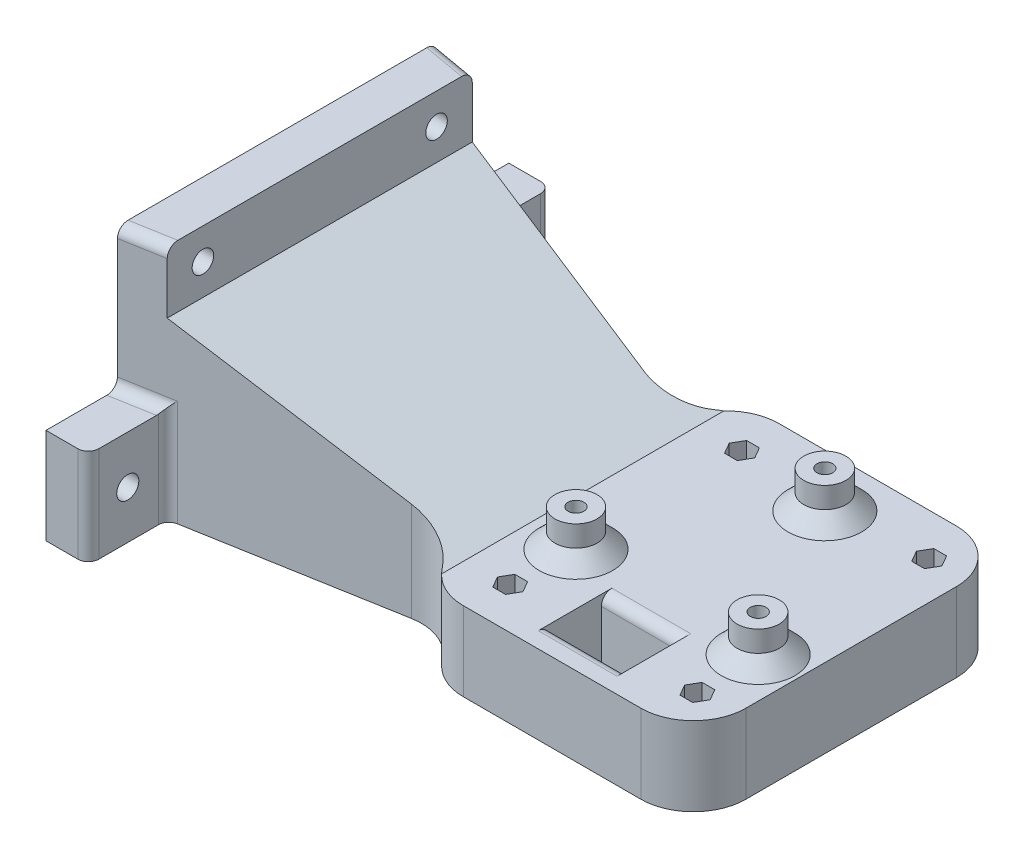
from build123d import *

# Parameters (mm, degrees)
EXTRUDE_1_DEPTH      = 5
EXTRUDE_1_DEPTH_BACK = 10
SKETCH_1_W           = 50
SKETCH_1_H           = 60
SKETCH_1_R           = 1
SKETCH_1_R_2         = 1.5
FILLET_1_R           = 10
SKETCH_5_R           = 4
SKETCH_5_R_2         = 1.5
EXTRUDE_3_DEPTH      = 7
SKETCH_6_R           = 3.5
CUT_EXTRUDE_1_DEPTH  = 6
SKETCH_7_W           = 15
SKETCH_7_H           = 10
CUT_EXTRUDE_2_DEPTH  = 42.833001327
CUT_EXTRUDE_3_DEPTH  = 10
CHAMFER_1_SIZE       = 3
FILLET_6_R           = 10
EXTRUDE_7_DEPTH      = 15
EXTRUDE_8_DEPTH      = 30
CHAMFER_2_SIZE       = 50
CHAMFER_2_SIZE2      = 18.198511713
SKETCH_16_R          = 2.05
CUT_EXTRUDE_4_DEPTH  = 30
FILLET_7_R           = 10
FILLET_8_R           = 10
SKETCH_17_W          = 15
SKETCH_17_H          = 18.198511713
SKETCH_17_R          = 2.1
EXTRUDE_9_DEPTH      = 8.046928804
FILLET_9_R           = 2
FILLET_10_R          = 2


with BuildPart() as part:
    # 草图1 → 凸台-拉伸1 (new, two sides: drawn at the far end of the back side and taken through both)
    with BuildSketch(Plane(origin=(0, 0, 0), x_dir=(1, 0, 0), z_dir=(0, 1, 0)).offset(-EXTRUDE_1_DEPTH_BACK)):
        Rectangle(SKETCH_1_W, SKETCH_1_H)
        with Locations(Location((-17.7955, 22.0345, 0), (0, 0, 270))):
            Circle(SKETCH_1_R, mode=Mode.SUBTRACT)
        with Locations(Location((17.7955, 22.0345, 0), (0, 0, 270))):
            Circle(SKETCH_1_R, mode=Mode.SUBTRACT)
        with Locations(Location((17.7955, -22.0345, 0), (0, 0, 90))):
            Circle(SKETCH_1_R, mode=Mode.SUBTRACT)
        with Locations(Location((-17.7955, -22.0345, 0), (0, 0, 90))):
            Circle(SKETCH_1_R, mode=Mode.SUBTRACT)
        with Locations(Location((-17.320508076, -10, 0), (0, 0, 270))):
            Circle(SKETCH_1_R_2, mode=Mode.SUBTRACT)
        with Locations(Location((17.320508076, -10, 0), (0, 0, 270))):
            Circle(SKETCH_1_R_2, mode=Mode.SUBTRACT)
        with Locations(Location((0, 20, 0), (0, 0, 270))):
            Circle(SKETCH_1_R_2, mode=Mode.SUBTRACT)
    extrude(amount=EXTRUDE_1_DEPTH + EXTRUDE_1_DEPTH_BACK)

    # 圆角1
    fillet_1_edges = [part.edges().sort_by_distance(p)[0] for p in [
        (25, -2.5, -30),
    ]]
    fillet(fillet_1_edges, radius=FILLET_1_R)

    # 草图5 → 凸台-拉伸3 (add)
    # profile 1 of 3: a face of its own
    with BuildSketch(Plane(origin=(0, 5, 0), x_dir=(1, 0, 0), z_dir=(0, 1, 0))):
        with Locations(Location((-17.320508076, -10, 0), (0, 0, 270))):
            Circle(SKETCH_5_R)
        with Locations(Location((-17.320508076, -10, 0), (0, 0, 270))):
            Circle(SKETCH_5_R_2, mode=Mode.SUBTRACT)
    # profile 2 of 3: a face of its own
    with BuildSketch(Plane(origin=(0, 5, 0), x_dir=(1, 0, 0), z_dir=(0, 1, 0))):
        with Locations(Location((17.320508076, -10, 0), (0, 0, 270))):
            Circle(SKETCH_5_R)
        with Locations(Location((17.320508076, -10, 0), (0, 0, 270))):
            Circle(SKETCH_5_R_2, mode=Mode.SUBTRACT)
    # profile 3 of 3: a face of its own
    with BuildSketch(Plane(origin=(0, 5, 0), x_dir=(1, 0, 0), z_dir=(0, 1, 0))):
        with Locations(Location((0, 20, 0), (0, 0, 270))):
            Circle(SKETCH_5_R)
        with Locations(Location((0, 20, 0), (0, 0, 270))):
            Circle(SKETCH_5_R_2, mode=Mode.SUBTRACT)
    extrude(amount=EXTRUDE_3_DEPTH)

    # 草图6 → 切除-拉伸1 (cut)
    with BuildSketch(Plane.XZ.offset(10)):
        with Locations(Location((-17.320508076, 10, 0), (0, 0, 270))):
            Circle(SKETCH_6_R)
        with Locations(Location((17.320508076, 10, 0), (0, 0, 270))):
            Circle(SKETCH_6_R)
        with Locations(Location((0, -20, 0), (0, 0, 270))):
            Circle(SKETCH_6_R)
    extrude(amount=-CUT_EXTRUDE_1_DEPTH, mode=Mode.SUBTRACT)

    # 草图7 → 切除-拉伸2 (cut, through all)
    with BuildSketch(Plane(origin=(0, 5, 0), x_dir=(1, 0, 0), z_dir=(0, 1, 0))):
        with Locations((0, -20)):
            Rectangle(SKETCH_7_W, SKETCH_7_H)
    extrude(amount=-CUT_EXTRUDE_2_DEPTH, mode=Mode.SUBTRACT)

    # 草图9 → 切除-拉伸3 (cut)
    with BuildSketch(Plane(origin=(0, 5, 0), x_dir=(1, 0, 0), z_dir=(0, 1, 0))):
        Polygon((-15.370628869, 22.0345), (-16.583064435, 24.1345), (-19.007935565, 24.1345), (-20.220371131, 22.0345), (-19.007935565, 19.9345), (-16.583064435, 19.9345), align=None)
        Polygon((20.220371131, 22.0345), (19.007935565, 24.1345), (16.583064435, 24.1345), (15.370628869, 22.0345), (16.583064435, 19.9345), (19.007935565, 19.9345), align=None)
        Polygon((20.220371131, -22.0345), (19.007935565, -19.9345), (16.583064435, -19.9345), (15.370628869, -22.0345), (16.583064435, -24.1345), (19.007935565, -24.1345), align=None)
        Polygon((-15.370628869, -22.0345), (-16.583064435, -19.9345), (-19.007935565, -19.9345), (-20.220371131, -22.0345), (-19.007935565, -24.1345), (-16.583064435, -24.1345), align=None)
    extrude(amount=-CUT_EXTRUDE_3_DEPTH, mode=Mode.SUBTRACT)

    # 倒角1
    chamfer_1_edges = [part.edges().sort_by_distance(p)[0] for p in [
        (17.320508076, 5, 6),
        (-17.320508076, 5, 6),
        (0, 5, -24),
    ]]
    chamfer(chamfer_1_edges, length=CHAMFER_1_SIZE)

    # 圆角6
    fillet_6_edges = [part.edges().sort_by_distance(p)[0] for p in [
        (25, -2.5, 30),
    ]]
    fillet(fillet_6_edges, radius=FILLET_6_R)

    # 草图13 → 凸台-拉伸7 (add)
    with BuildSketch(Plane(origin=(0, 5, 0), x_dir=(1, 0, 0), z_dir=(0, 1, 0))):
        Polygon((-25, 20), (-84.088465181, 30.41889066), (-84.088465181, -30.41889066), (-25, -20), align=None)
    extrude(amount=-EXTRUDE_7_DEPTH)

    # 草图15 → 凸台-拉伸8 (add)
    with BuildSketch(Plane(origin=(0, 5, 0), x_dir=(1, 0, 0), z_dir=(0, 1, 0))):
        Polygon((-84.088465181, 30.41889066), (-84.088465181, -30.41889066), (-76.041536377, -29), (-76.041536377, 29), align=None)
    extrude(amount=EXTRUDE_8_DEPTH)

    # 倒角2
    chamfer_2_edges = [part.edges().sort_by_distance(p)[0] for p in [
        (-76.041536377, 5, 0),
    ]]
    chamfer_2_side = [part.faces().sort_by_distance(p)[0] for p in [
        (-27.426102069, 5, -0.626933824),
    ]]
    chamfer(chamfer_2_edges, length=CHAMFER_2_SIZE, length2=CHAMFER_2_SIZE2, reference=chamfer_2_side[0])

    # 草图16 → 切除-拉伸4 (cut)
    with BuildSketch(Plane(origin=(-76.041536377, 0, 0), x_dir=(0, 0, -1), z_dir=(1, 0, 0))):
        with Locations((-22.210107848, 29.099255857)):
            Circle(SKETCH_16_R)
        with Locations(Location((22.210107848, 29.099255857, 0), (0, 0, 180))):
            Circle(SKETCH_16_R)
    extrude(amount=-CUT_EXTRUDE_4_DEPTH, mode=Mode.SUBTRACT)

    # 圆角7
    # the kernel refuses this fillet: 10 mm, written as the material it adds along each edge
    with BuildSketch(Plane(origin=(-25, 5, 20), x_dir=(-0.9848077530122087, 0, 0.1736481776669271), z_dir=(0, -1, 0))) as fillet_7_piece_1_section:
        with BuildLine():
            CenterArc((11.735327688, -10), FILLET_7_R, 90, 89.129514879)
            Line((1.736481777, -9.84807753), (1.536504858, -9.845039081))
            ThreePointArc((1.536504858, -9.845039081), (0.671279338, -4.958768401), (-0.196961551, -0.034729636))
            Line((-0.196961551, -0.034729636), (0, 0.2))
            Line((0, 0.2), (11.735327688, 0.2))
            Line((11.735327688, 0.2), (11.735327688, 0))
        make_face()
    fillet_7_piece_1 = extrude(amount=15, mode=Mode.PRIVATE)
    fillet_7_piece_1 = split(fillet_7_piece_1, bisect_by=Plane(origin=(-25.238476419, 4.707710079, 24.535111485), z_dir=(0.34202014332566943, 0.9396926207859082, 0)), keep=Keep.TOP, mode=Mode.PRIVATE)
    add(fillet_7_piece_1)
    with BuildSketch(Plane(origin=(-25, 34.338319221, 20), x_dir=(-0.9848077530122086, 0, 0.1736481776669274), z_dir=(0, -1, 0))) as fillet_7_piece_2_section:
        with BuildLine():
            CenterArc((11.735327688, -10), FILLET_7_R, 90, 89.129514879)
            Line((1.736481777, -9.84807753), (1.536504858, -9.845039081))
            ThreePointArc((1.536504858, -9.845039081), (0.671279338, -4.958768401), (-0.196961551, -0.034729636))
            Line((-0.196961551, -0.034729636), (0, 0.2))
            Line((0, 0.2), (11.735327688, 0.2))
            Line((11.735327688, 0.2), (11.735327688, 0))
        make_face()
    fillet_7_piece_2 = extrude(amount=44.338319221, mode=Mode.PRIVATE)
    fillet_7_piece_2 = split(fillet_7_piece_2, bisect_by=Plane(origin=(-30.668809733, 5, 21.998884798), z_dir=(0, 1, 0)), keep=Keep.TOP, mode=Mode.PRIVATE)
    fillet_7_piece_2 = split(fillet_7_piece_2, bisect_by=Plane(origin=(-30.398165654, 6.585683379, 21.998884798), z_dir=(-0.34202014332566943, -0.9396926207859082, 0)), keep=Keep.TOP, mode=Mode.PRIVATE)
    add(fillet_7_piece_2)
    with BuildSketch(Plane(origin=(-25, 5, 20), x_dir=(-0.9848077530122087, 0, 0.1736481776669271), z_dir=(0, -1, 0))) as fillet_7_piece_3_section:
        with BuildLine():
            CenterArc((11.735327688, -10), FILLET_7_R, 90, 89.129514879)
            Line((1.736481777, -9.84807753), (1.536504858, -9.845039081))
            ThreePointArc((1.536504858, -9.845039081), (0.671279338, -4.958768401), (-0.196961551, -0.034729636))
            Line((-0.196961551, -0.034729636), (0, 0.2))
            Line((0, 0.2), (11.735327688, 0.2))
            Line((11.735327688, 0.2), (11.735327688, 0))
        make_face()
    fillet_7_piece_3 = extrude(amount=15, mode=Mode.PRIVATE)
    fillet_7_piece_3 = split(fillet_7_piece_3, bisect_by=Plane(origin=(-25.122308075, 4.66542826, 23.000783261), z_dir=(-0.34202014332566943, -0.9396926207859082, 0)), keep=Keep.TOP, mode=Mode.PRIVATE)
    add(fillet_7_piece_3)
    with BuildSketch(Plane(origin=(-25, 5, -20), x_dir=(-0.9848077530122087, 0, -0.1736481776669263), z_dir=(0, -1, 0))) as fillet_7_piece_4_section:
        with BuildLine():
            CenterArc((11.735327688, 10), FILLET_7_R, 180.870485121, 89.129514879)
            Line((1.736481777, 9.84807753), (1.536504858, 9.845039081))
            ThreePointArc((1.536504858, 9.845039081), (0.671279338, 4.958768401), (-0.196961551, 0.034729636))
            Line((-0.196961551, 0.034729636), (0, -0.2))
            Line((0, -0.2), (11.735327688, -0.2))
            Line((11.735327688, -0.2), (11.735327688, 0))
        make_face()
    fillet_7_piece_4 = extrude(amount=15, mode=Mode.PRIVATE)
    fillet_7_piece_4 = split(fillet_7_piece_4, bisect_by=Plane(origin=(-25.238476419, 4.707710079, -24.535111485), z_dir=(0.34202014332566943, 0.9396926207859082, 0)), keep=Keep.TOP, mode=Mode.PRIVATE)
    add(fillet_7_piece_4)
    with BuildSketch(Plane(origin=(-25, 34.338319221, -20), x_dir=(-0.9848077530122087, 0, -0.17364817766692656), z_dir=(0, -1, 0))) as fillet_7_piece_5_section:
        with BuildLine():
            CenterArc((11.735327688, 10), FILLET_7_R, 180.870485121, 89.129514879)
            Line((1.736481777, 9.84807753), (1.536504858, 9.845039081))
            ThreePointArc((1.536504858, 9.845039081), (0.671279338, 4.958768401), (-0.196961551, 0.034729636))
            Line((-0.196961551, 0.034729636), (0, -0.2))
            Line((0, -0.2), (11.735327688, -0.2))
            Line((11.735327688, -0.2), (11.735327688, 0))
        make_face()
    fillet_7_piece_5 = extrude(amount=44.338319221, mode=Mode.PRIVATE)
    fillet_7_piece_5 = split(fillet_7_piece_5, bisect_by=Plane(origin=(-30.668809733, 5, -21.998884798), z_dir=(0, 1, 0)), keep=Keep.TOP, mode=Mode.PRIVATE)
    fillet_7_piece_5 = split(fillet_7_piece_5, bisect_by=Plane(origin=(-30.398165654, 6.585683379, -21.998884798), z_dir=(-0.34202014332566943, -0.9396926207859082, 0)), keep=Keep.TOP, mode=Mode.PRIVATE)
    add(fillet_7_piece_5)
    with BuildSketch(Plane(origin=(-25, 5, -20), x_dir=(-0.9848077530122087, 0, -0.1736481776669263), z_dir=(0, -1, 0))) as fillet_7_piece_6_section:
        with BuildLine():
            CenterArc((11.735327688, 10), FILLET_7_R, 180.870485121, 89.129514879)
            Line((1.736481777, 9.84807753), (1.536504858, 9.845039081))
            ThreePointArc((1.536504858, 9.845039081), (0.671279338, 4.958768401), (-0.196961551, 0.034729636))
            Line((-0.196961551, 0.034729636), (0, -0.2))
            Line((0, -0.2), (11.735327688, -0.2))
            Line((11.735327688, -0.2), (11.735327688, 0))
        make_face()
    fillet_7_piece_6 = extrude(amount=15, mode=Mode.PRIVATE)
    fillet_7_piece_6 = split(fillet_7_piece_6, bisect_by=Plane(origin=(-25.122308075, 4.66542826, -23.000783261), z_dir=(-0.34202014332566943, -0.9396926207859082, 0)), keep=Keep.TOP, mode=Mode.PRIVATE)
    add(fillet_7_piece_6)

    # 圆角8
    # the kernel refuses this fillet: 10 mm, written as the material it takes off along each edge
    with BuildSketch(Plane(origin=(-25, -25.66096469, 30), x_dir=(1, 0, 0), z_dir=(0, 1, 0))) as fillet_8_piece_1:
        with BuildLine():
            CenterArc((6.264385876, 10), FILLET_8_R, 216.462375582, 53.537624418)
            ThreePointArc((-1.778087019, 4.057052101), (-0.661580538, 2.128216404), (0, 0))
            Line((0, 0), (6.264385876, 0))
        make_face()
    extrude(amount=46.321929379, mode=Mode.SUBTRACT)
    with BuildSketch(Plane(origin=(-25, 20.66096469, -30), x_dir=(-0.4014112201637374, 0, 0.9158979377237726), z_dir=(0, -1, 0))) as fillet_8_piece_2:
        with BuildLine():
            CenterArc((6.644384599, -9.751650306), FILLET_8_R, 102.79594523, 53.537624418)
            Line((-2.514594778, -5.737538105), (0, 0))
            ThreePointArc((0, 0), (2.214794866, -0.248349694), (4.429589733, 0))
        make_face()
    extrude(amount=46.321929379, mode=Mode.SUBTRACT)

    # 草图17 → 凸台-拉伸9 (add)
    # profile 1 of 2: a face of its own
    with BuildSketch(Plane(origin=(-76.041536377, 0, 0), x_dir=(0, 0, -1), z_dir=(1, 0, 0))):
        with Locations((-36.5, -0.900744143)):
            Rectangle(SKETCH_17_W, SKETCH_17_H)
        with Locations((-36.5, -0.900744143)):
            Circle(SKETCH_17_R, mode=Mode.SUBTRACT)
    # profile 2 of 2: a face of its own
    with BuildSketch(Plane(origin=(-76.041536377, 0, 0), x_dir=(0, 0, -1), z_dir=(1, 0, 0))):
        with Locations((36.5, -0.900744143)):
            Rectangle(SKETCH_17_W, SKETCH_17_H)
        with Locations(Location((36.5, -0.900744143, 0), (0, 0, 180))):
            Circle(SKETCH_17_R, mode=Mode.SUBTRACT)
    extrude(amount=-EXTRUDE_9_DEPTH)

    # 圆角9
    fillet_9_edges = [part.edges().sort_by_distance(p)[0] for p in [
        (-80.065000779, 8.198511713, -29.70944533),
        (-80.065000779, 8.198511713, 29.70944533),
        (-76.041536377, -0.900744143, -44),
        (-76.041536377, -0.900744143, 44),
        (-80.065000779, 35, 29.70944533),
        (-80.065000779, 35, -29.70944533),
        (-76.041536377, -0.900744143, 29),
        (-76.041536377, -0.900744143, -29),
    ]]
    fillet(fillet_9_edges, radius=FILLET_9_R)

    # 圆角10
    fillet_10_edges = [part.edges().sort_by_distance(p)[0] for p in [
        (0, -10, 25),
        (0, -10, 15),
        (0, 5, 15),
        (0, 5, 25),
    ]]
    fillet(fillet_10_edges, radius=FILLET_10_R)


solid = part.part
